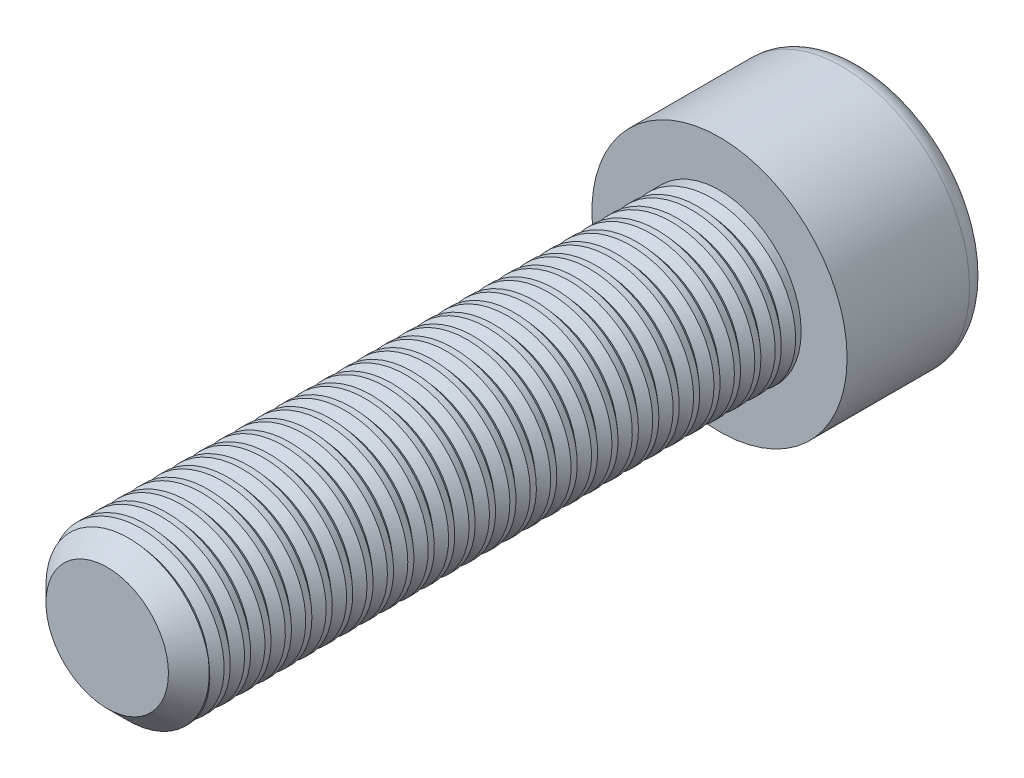
from build123d import *

# Parameters (mm, degrees)
SKETCH_1_R          = 6.25
EXTRUDE_1_DEPTH     = 7
SKETCH_2_R          = 4
EXTRUDE_2_DEPTH     = 30
CHAMFER_1_SIZE      = 1
SWEEP_1_PITCH       = 1
CUT_EXTRUDE_1_DEPTH = 3
FILLET_1_R          = 1


with BuildPart() as part:
    # 草图1 → 凸台-拉伸1 (new body)
    with BuildSketch(Plane.XY):
        Circle(SKETCH_1_R)
    extrude(amount=EXTRUDE_1_DEPTH)

    # 草图2 → 凸台-拉伸2 (add)
    with BuildSketch(Plane.XY.offset(7)):
        Circle(SKETCH_2_R)
    extrude(amount=EXTRUDE_2_DEPTH)

    # 倒角1
    chamfer_1_edges = [part.edges().sort_by_distance(p)[0] for p in [
        (-4, 0, 37),
    ]]
    chamfer(chamfer_1_edges, length=CHAMFER_1_SIZE)

    # 切除-扫描1: arcs per turn and ends read off the stored shape
    # 切除-扫描1: the profile of 草图4 profile screwed along a right-hand helix through 30 turns, 8 arcs to a turn; built about Z, then put on its axis
    sweep_1_z = Axis((0, 0, 0), (0, 0, 1))
    sweep_1_corners = [(4.0003, 0, -0.350262523), (4.0003, 0, 0.350262477), (3.6, 0, -2.3e-08)]
    with BuildLine(mode=Mode.PRIVATE) as sweep_1_profile:
        Line(sweep_1_corners[0], sweep_1_corners[1])
        Line(sweep_1_corners[1], sweep_1_corners[2])
        Line(sweep_1_corners[2], sweep_1_corners[0])
    sweep_1_cap = Face(sweep_1_profile.wire())
    sweep_1_turn_angles = [0, 22.5, 45, 67.5, 90, 112.5, 135, 157.5, 180, 202.5, 225, 247.5, 270, 292.5, 315, 337.5, 360]
    sweep_1_turn_weights = [1, 0.9238795325112867, 1, 0.9238795325112867, 1, 0.9238795325112867, 1, 0.9238795325112867, 1, 0.9238795325112867, 1, 0.9238795325112867, 1, 0.9238795325112867, 1, 0.9238795325112867, 1]
    sweep_1_turn_rails = [Edge.make_bspline([Vector(p[0], p[1], 0).rotate(sweep_1_z, sweep_1_turn_angles[k]) / sweep_1_turn_weights[k] + Vector(0, 0, p[2] + SWEEP_1_PITCH * sweep_1_turn_angles[k] / 360) for k in range(17)], [0, 0, 0, 1, 1, 2, 2, 3, 3, 4, 4, 5, 5, 6, 6, 7, 7, 8, 8, 8], 2, sweep_1_turn_weights) for p in sweep_1_corners]
    sweep_1_turn_sides = [Face.make_surface_from_curves(sweep_1_turn_rails[p[0]], sweep_1_turn_rails[p[1]]) for p in [(0, 1), (1, 2), (2, 0)]]
    sweep_1_turn = Solid(Shell([*sweep_1_turn_sides, sweep_1_cap, sweep_1_cap.rotate(sweep_1_z, 360).moved(Location((0, 0, SWEEP_1_PITCH * 360 / 360)))]))
    sweep_1_each = [*[sweep_1_turn.moved(Location((0, 0, SWEEP_1_PITCH * i))) for i in range(30)]]
    add(Plane(origin=(0, 0, 37), x_dir=(-0.7071067811865512, 0.7071067811865438, 0), z_dir=(0, 0, -1)) * Compound([sweep_1_each[i] for i in range(0, 30, 2)]), mode=Mode.SUBTRACT)
    add(Plane(origin=(0, 0, 37), x_dir=(-0.7071067811865512, 0.7071067811865438, 0), z_dir=(0, 0, -1)) * Compound([sweep_1_each[i] for i in range(1, 30, 2)]), mode=Mode.SUBTRACT)

    # 草图5 → 切除-拉伸1 (cut)
    with BuildSketch(Plane(origin=(0, 0, 0), x_dir=(-1, 0, 0), z_dir=(0, 0, -1))):
        Polygon((2.399617223, 2.498366903), (-0.963840594, 3.327312926), (-3.363457818, 0.828946023), (-2.399617223, -2.498366903), (0.963840594, -3.327312926), (3.363457818, -0.828946023), align=None)
    extrude(amount=-CUT_EXTRUDE_1_DEPTH, mode=Mode.SUBTRACT)

    # 圆角1
    fillet_1_edges = [part.edges().sort_by_distance(p)[0] for p in [
        (-6.25, 0, 0),
    ]]
    fillet(fillet_1_edges, radius=FILLET_1_R)


solid = part.part
